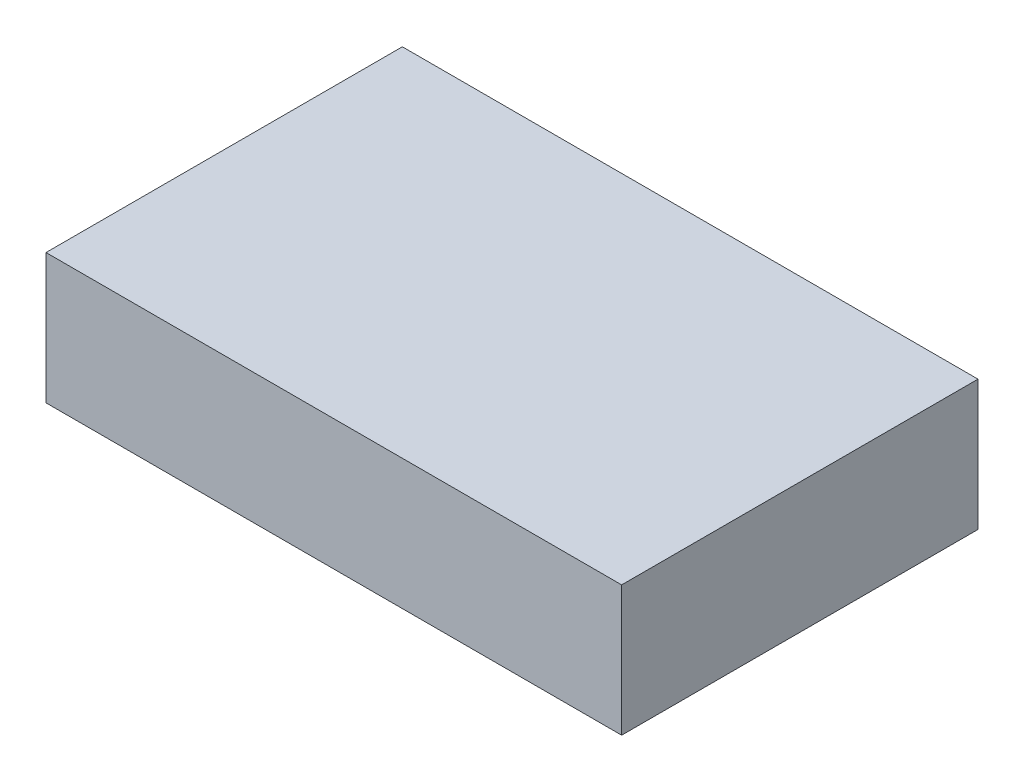
from build123d import *

# Parameters (mm, degrees)
SKETCH_1_W      = 42
SKETCH_1_H      = 26
EXTRUDE_1_DEPTH = 9.5


with BuildPart() as part:
    # 草图1 → 凸台-拉伸1 (new body)
    with BuildSketch(Plane(origin=(0, 0, 0), x_dir=(1, 0, 0), z_dir=(0, 1, 0))):
        Rectangle(SKETCH_1_W, SKETCH_1_H)
    extrude(amount=EXTRUDE_1_DEPTH)


solid = part.part
